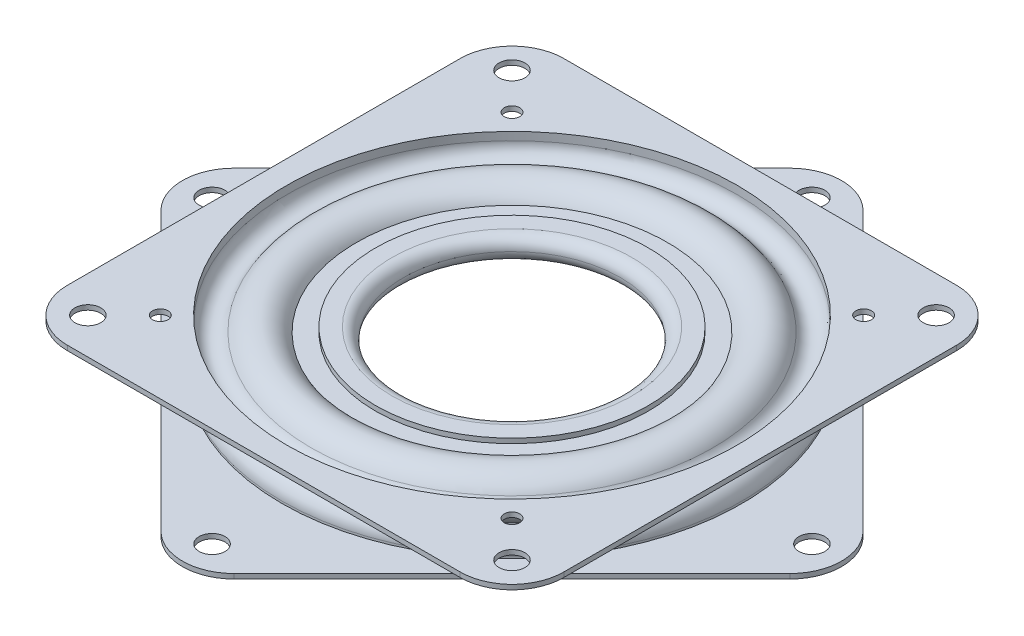
from build123d import *

# Parameters (mm, degrees)
SKETCH2_R                                 = 34.557781481
EXTRUDE1_DEPTH                            = 0.7366
EXTRUDE2_START                            = -0.7366
SKETCH3_W                                 = 76.2
SKETCH3_H                                 = 76.2
SKETCH3_R                                 = 34.557781481
EXTRUDE2_DEPTH                            = 0.7366
CIRPATTERN1_COUNT                         = 3
FILLET1_R                                 = 7.9502
FILLET2_R                                 = 7.9502
SKETCH5_W                                 = 1.984375
SKETCH5_H                                 = 0.7366
F_5_32_0_156250_DIAMETER_HOLE1_AT_2_COUNT = 2
F_5_32_0_156250_DIAMETER_HOLE1_AT_2_PITCH = 65.1002
F_5_32_0_156250_DIAMETER_HOLE1_AT_3_COUNT = 2
F_5_32_0_156250_DIAMETER_HOLE1_AT_3_PITCH = 65.1002
F_5_32_0_156250_DIAMETER_HOLE1_AT_4_COUNT = 2
F_5_32_0_156250_DIAMETER_HOLE1_AT_4_PITCH = 92.065585753
SKETCH7_W                                 = 1.984375
SKETCH7_H                                 = 8.128
F_5_32_0_156250_DIAMETER_HOLE2_AT_2_COUNT = 2
F_5_32_0_156250_DIAMETER_HOLE2_AT_2_PITCH = 65.1002
F_5_32_0_156250_DIAMETER_HOLE2_AT_3_COUNT = 2
F_5_32_0_156250_DIAMETER_HOLE2_AT_3_PITCH = 92.065585753
F_5_32_0_156250_DIAMETER_HOLE2_AT_4_COUNT = 2
F_5_32_0_156250_DIAMETER_HOLE2_AT_4_PITCH = 65.1002
F_3_32_0_09375_DIAMETER_HOLE1_AT_2_COUNT  = 2
F_3_32_0_09375_DIAMETER_HOLE1_AT_2_PITCH  = 53.975
F_3_32_0_09375_DIAMETER_HOLE1_AT_3_COUNT  = 2
F_3_32_0_09375_DIAMETER_HOLE1_AT_3_PITCH  = 76.332177029
F_3_32_0_09375_DIAMETER_HOLE1_AT_4_COUNT  = 2
F_3_32_0_09375_DIAMETER_HOLE1_AT_4_PITCH  = 53.975


with BuildPart() as part:
    # Sketch1 → Revolve-Thin4 (revolve)
    with BuildSketch(Plane.XY, mode=Mode.PRIVATE) as revolve_thin4_sk:
        with BuildLine():
            Line((20.959011942, 1.778), (18.415, 1.778))
            ThreePointArc((18.415, 1.778), (16.637, 0), (18.415, -1.778))
            Line((18.415, -1.778), (23.503023884, -1.778))
            ThreePointArc((23.503023884, -1.778), (26.822976031, -4.788389506), (30.836320987, -2.794))
            ThreePointArc((30.836320987, -2.794), (33.072287853, -1.842454994), (34.557781481, -3.76555))
            Line((34.557781481, -3.76555), (34.557781481, -4.826))
            Line((34.557781481, -4.826), (38.1, -4.826))
            Line((38.1, -4.826), (38.1, -4.0894))
            Line((38.1, -4.0894), (35.294381481, -4.0894))
            Line((35.294381481, -4.0894), (35.294381481, -3.76555))
            ThreePointArc((35.294381481, -3.76555), (33.258353473, -1.129742468), (30.193721571, -2.433936741))
            ThreePointArc((30.193721571, -2.433936741), (26.643008112, -4.007091339), (24.135607796, -1.0414))
            Line((24.135607796, -1.0414), (18.415, -1.0414))
            ThreePointArc((18.415, -1.0414), (17.3736, 0), (18.415, 1.0414))
            Line((18.415, 1.0414), (20.959011942, 1.0414))
            Line((20.959011942, 1.0414), (20.959011942, 1.778))
        make_face()
    revolve(revolve_thin4_sk.sketch.rotate(Axis((0, 21.71272626, 0), (0, -1, 0)), 90), axis=Axis((0, 21.71272626, 0), (0, -1, 0)))

    # Sketch2 → Extrude1 (add)
    with BuildSketch(Plane.XZ.offset(4.826)):
        Polygon((53.881536726, 0), (0, -53.881536726), (-53.881536726, 0), (0, 53.881536726), align=None)
        with Locations(Location((0, 0, 0), (0, 0, 90))):
            Circle(SKETCH2_R, mode=Mode.SUBTRACT)
    extrude(amount=-EXTRUDE1_DEPTH)

    # Fillet2
    fillet2_edges = [part.edges().sort_by_distance(p)[0] for p in [
        (0, -4.4577, -53.881536726),
        (-53.881536726, -4.4577, 0),
        (0, -4.4577, 53.881536726),
        (53.881536726, -4.4577, 0),
    ]]
    fillet(fillet2_edges, radius=FILLET2_R)

    # Sketch5 → 5/32 (0.156250) Diameter Hole1 (revolve, cut)
    with BuildSketch(Plane(origin=(0, -4.0894, -46.032792877), x_dir=(0, 0, 1), z_dir=(1, 0, 0))):
        with Locations((0.9921875, 0.3683)):
            Rectangle(SKETCH5_W, SKETCH5_H)
    f_5_32_0_156250_diameter_hole1 = revolve(axis=Axis((0, 2.2606, -46.032792877), (0, -1, 0)), mode=Mode.SUBTRACT)

    # 5/32 (0.156250) Diameter Hole1 at 2: 5/32 (0.156250) Diameter Hole1 ×2
    with Locations(*[Vector(0.7071067811865476, 0, 0.7071067811865475) * (i * F_5_32_0_156250_DIAMETER_HOLE1_AT_2_PITCH) for i in range(1, F_5_32_0_156250_DIAMETER_HOLE1_AT_2_COUNT)]):
        add(f_5_32_0_156250_diameter_hole1, mode=Mode.SUBTRACT)

    # 5/32 (0.156250) Diameter Hole1 at 3: 5/32 (0.156250) Diameter Hole1 ×2
    with Locations(*[Vector(-0.7071067811865475, 0, 0.7071067811865477) * (i * F_5_32_0_156250_DIAMETER_HOLE1_AT_3_PITCH) for i in range(1, F_5_32_0_156250_DIAMETER_HOLE1_AT_3_COUNT)]):
        add(f_5_32_0_156250_diameter_hole1, mode=Mode.SUBTRACT)

    # 5/32 (0.156250) Diameter Hole1 at 4: 5/32 (0.156250) Diameter Hole1 ×2
    with Locations(*[(0, 0, i * F_5_32_0_156250_DIAMETER_HOLE1_AT_4_PITCH) for i in range(1, F_5_32_0_156250_DIAMETER_HOLE1_AT_4_COUNT)]):
        add(f_5_32_0_156250_diameter_hole1, mode=Mode.SUBTRACT)


with BuildPart() as body_2:
    # Sketch1<5> → Revolve-Thin5 (revolve)
    with BuildSketch(Plane.XY, mode=Mode.PRIVATE) as revolve_thin5_sk:
        with BuildLine():
            Line((18.415, 1.0414), (23.872699559, 1.0414))
            ThreePointArc((23.872699559, 1.0414), (27.339502199, 3.124094231), (30.836320987, 1.0922))
            ThreePointArc((30.836320987, 1.0922), (33.072287853, 0.140654994), (34.557781481, 2.06375))
            Line((34.557781481, 2.06375), (34.557781481, 3.302))
            Line((34.557781481, 3.302), (38.1, 3.302))
            Line((38.1, 3.302), (38.1, 2.5654))
            Line((38.1, 2.5654), (35.294381481, 2.5654))
            Line((35.294381481, 2.5654), (35.294381481, 2.06375))
            ThreePointArc((35.294381481, 2.06375), (33.258353473, -0.572057532), (30.193721571, 0.732136741))
            ThreePointArc((30.193721571, 0.732136741), (27.132579028, 2.378995284), (24.343233109, 0.3048))
            Line((24.343233109, 0.3048), (18.415, 0.3048))
            Line((18.415, 0.3048), (18.415, 1.0414))
        make_face()
    revolve(revolve_thin5_sk.sketch.rotate(Axis((0, 21.71272626, 0), (0, -1, 0)), 90), axis=Axis((0, 21.71272626, 0), (0, -1, 0)))

    # Sketch3 → Extrude2 (add)
    with BuildSketch(Plane(origin=(0, 3.302, 0), x_dir=(-1, 0, 0), z_dir=(0, 1, 0)).offset(EXTRUDE2_START)):
        Rectangle(SKETCH3_W, SKETCH3_H)
        with Locations(Location((0, 0, 0), (0, 0, 90))):
            Circle(SKETCH3_R, mode=Mode.SUBTRACT)
    extrude(amount=EXTRUDE2_DEPTH)

    # Fillet1
    fillet1_edges = [body_2.edges().sort_by_distance(p)[0] for p in [
        (-38.1, 2.9337, -38.1),
        (-38.1, 2.9337, 38.1),
        (38.1, 2.9337, 38.1),
        (38.1, 2.9337, -38.1),
    ]]
    fillet(fillet1_edges, radius=FILLET1_R)

    # Sketch7 → 5/32 (0.156250) Diameter Hole2 (revolve, cut)
    with BuildSketch(Plane(origin=(32.5501, 3.302, -32.5501), x_dir=(0, 0, 1), z_dir=(1, 0, 0))):
        with Locations((0.9921875, 4.064)):
            Rectangle(SKETCH7_W, SKETCH7_H)
    f_5_32_0_156250_diameter_hole2 = revolve(axis=Axis((32.5501, 9.652, -32.5501), (0, -1, 0)), mode=Mode.SUBTRACT)

    # 5/32 (0.156250) Diameter Hole2 at 2: 5/32 (0.156250) Diameter Hole2 ×2
    with Locations(*[(-i * F_5_32_0_156250_DIAMETER_HOLE2_AT_2_PITCH, 0, 0) for i in range(1, F_5_32_0_156250_DIAMETER_HOLE2_AT_2_COUNT)]):
        add(f_5_32_0_156250_diameter_hole2, mode=Mode.SUBTRACT)

    # 5/32 (0.156250) Diameter Hole2 at 3: 5/32 (0.156250) Diameter Hole2 ×2
    with Locations(*[Vector(-0.7071067811865476, 0, 0.7071067811865476) * (i * F_5_32_0_156250_DIAMETER_HOLE2_AT_3_PITCH) for i in range(1, F_5_32_0_156250_DIAMETER_HOLE2_AT_3_COUNT)]):
        add(f_5_32_0_156250_diameter_hole2, mode=Mode.SUBTRACT)

    # 5/32 (0.156250) Diameter Hole2 at 4: 5/32 (0.156250) Diameter Hole2 ×2
    with Locations(*[(0, 0, i * F_5_32_0_156250_DIAMETER_HOLE2_AT_4_PITCH) for i in range(1, F_5_32_0_156250_DIAMETER_HOLE2_AT_4_COUNT)]):
        add(f_5_32_0_156250_diameter_hole2, mode=Mode.SUBTRACT)

    # Sketch9 → 3/32 (0.09375) Diameter Hole1 (revolve, cut)
    with BuildSketch(Plane(origin=(-26.9875, 3.302, -26.9875), x_dir=(0, 0, 1), z_dir=(1, 0, 0))):
        Polygon((0, 0), (0, 3.890781221), (1.19126, 3.175), (1.19126, 0), align=None)
    f_3_32_0_09375_diameter_hole1 = revolve(axis=Axis((-26.9875, 9.652, -26.9875), (0, -1, 0)), mode=Mode.SUBTRACT)

    # 3/32 (0.09375) Diameter Hole1 at 2: 3/32 (0.09375) Diameter Hole1 ×2
    with Locations(*[(i * F_3_32_0_09375_DIAMETER_HOLE1_AT_2_PITCH, 0, 0) for i in range(1, F_3_32_0_09375_DIAMETER_HOLE1_AT_2_COUNT)]):
        add(f_3_32_0_09375_diameter_hole1, mode=Mode.SUBTRACT)

    # 3/32 (0.09375) Diameter Hole1 at 3: 3/32 (0.09375) Diameter Hole1 ×2
    with Locations(*[Vector(0.7071067811865476, 0, 0.7071067811865476) * (i * F_3_32_0_09375_DIAMETER_HOLE1_AT_3_PITCH) for i in range(1, F_3_32_0_09375_DIAMETER_HOLE1_AT_3_COUNT)]):
        add(f_3_32_0_09375_diameter_hole1, mode=Mode.SUBTRACT)

    # 3/32 (0.09375) Diameter Hole1 at 4: 3/32 (0.09375) Diameter Hole1 ×2
    with Locations(*[(0, 0, i * F_3_32_0_09375_DIAMETER_HOLE1_AT_4_PITCH) for i in range(1, F_3_32_0_09375_DIAMETER_HOLE1_AT_4_COUNT)]):
        add(f_3_32_0_09375_diameter_hole1, mode=Mode.SUBTRACT)


with BuildPart() as body_3:
    # Sketch4 → Revolve1 (revolve)
    with BuildSketch(Plane.XY):
        with BuildLine():
            Line((27.3685, 2.5146), (27.3685, -4.2164))
            ThreePointArc((27.3685, -4.2164), (30.734, -0.8509), (27.3685, 2.5146))
        make_face()
    revolve(axis=Axis((27.3685, 2.837450101, 0), (0, -1, 0)))


with BuildPart() as cirpattern1_1:
    # CirPattern1: pattern copy
    add(body_3.part.rotate(Axis((0, 0, 0), (0, 1, 0)), 1 * 360 / CIRPATTERN1_COUNT))


with BuildPart() as cirpattern1_2:
    # CirPattern1: pattern copy
    add(body_3.part.rotate(Axis((0, 0, 0), (0, 1, 0)), 2 * 360 / CIRPATTERN1_COUNT))


solid = Compound([part.part, body_2.part, body_3.part, cirpattern1_1.part, cirpattern1_2.part])
